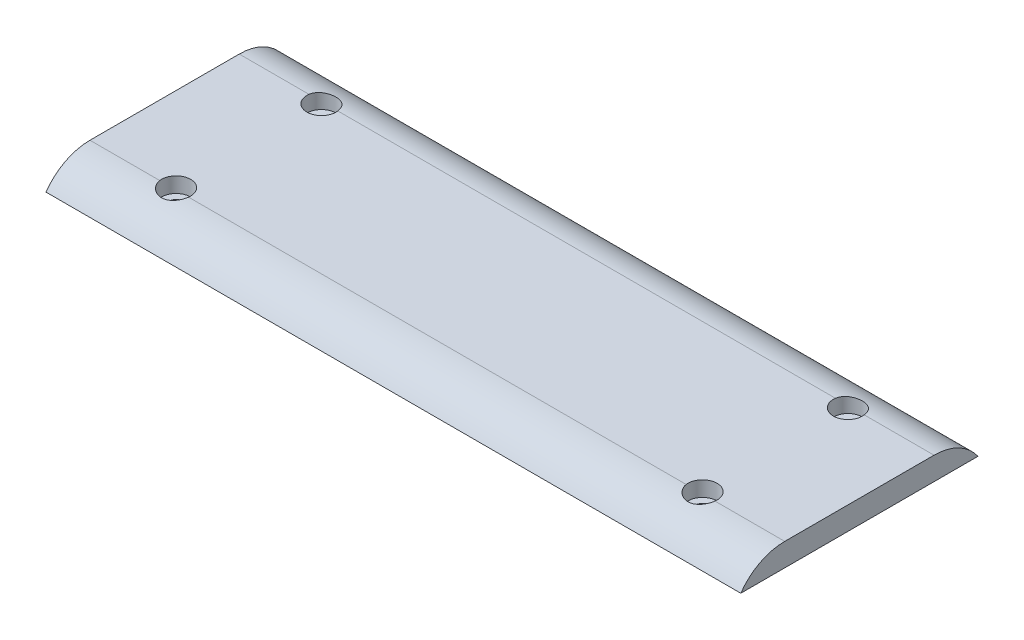
from build123d import *

# Parameters (mm, degrees)
SKETCH1_W           = 90.8
SKETCH1_H           = 31
BOSS_EXTRUDE1_DEPTH = 3
SKETCH2_R           = 0.95
CUT_EXTRUDE1_DEPTH  = 3
SKETCH3_R           = 1.9
CUT_EXTRUDE2_DEPTH  = 2
SKETCH4_W           = 54
SKETCH4_H           = 7
BOSS_EXTRUDE2_DEPTH = 5
SKETCH5_R           = 3.9
CUT_EXTRUDE3_DEPTH  = 54
FILLET1_R           = 7


with BuildPart() as part:
    # Sketch1 → Boss-Extrude1 (new body)
    with BuildSketch(Plane(origin=(0, 0, 0), x_dir=(1, 0, 0), z_dir=(0, 1, 0))):
        Rectangle(SKETCH1_W, SKETCH1_H)
    extrude(amount=BOSS_EXTRUDE1_DEPTH)

    # Sketch2 → Cut-Extrude1 (cut)
    with BuildSketch(Plane(origin=(0, 3, 0), x_dir=(1, 0, 0), z_dir=(0, 1, 0))):
        with Locations(Location((-34.4, 9.5, 0), (0, 0, 270))):
            Circle(SKETCH2_R)
        with Locations(Location((34.4, 9.5, 0), (0, 0, 270))):
            Circle(SKETCH2_R)
        with Locations(Location((-34.4, -9.5, 0), (0, 0, 270))):
            Circle(SKETCH2_R)
        with Locations(Location((34.4, -9.5, 0), (0, 0, 270))):
            Circle(SKETCH2_R)
    extrude(amount=-CUT_EXTRUDE1_DEPTH, mode=Mode.SUBTRACT)

    # Sketch3 → Cut-Extrude2 (cut)
    with BuildSketch(Plane(origin=(0, 3, 0), x_dir=(1, 0, 0), z_dir=(0, 1, 0))):
        with Locations(Location((-34.4, 9.5, 0), (0, 0, 270))):
            Circle(SKETCH3_R)
        with Locations(Location((-34.4, -9.5, 0), (0, 0, 270))):
            Circle(SKETCH3_R)
        with Locations(Location((34.4, 9.5, 0), (0, 0, 270))):
            Circle(SKETCH3_R)
        with Locations(Location((34.4, -9.5, 0), (0, 0, 270))):
            Circle(SKETCH3_R)
    extrude(amount=-CUT_EXTRUDE2_DEPTH, mode=Mode.SUBTRACT)

    # Sketch4 → Boss-Extrude2 (add)
    with BuildSketch(Plane.XZ):
        Rectangle(SKETCH4_W, SKETCH4_H)
    extrude(amount=BOSS_EXTRUDE2_DEPTH)

    # Sketch5 → Cut-Extrude3 (cut)
    with BuildSketch(Plane(origin=(27, 0, 0), x_dir=(0, 0, -1), z_dir=(1, 0, 0))):
        with Locations((0, -6.130658567)):
            Circle(SKETCH5_R)
    extrude(amount=-CUT_EXTRUDE3_DEPTH, mode=Mode.SUBTRACT)

    # Fillet1
    # the kernel refuses this fillet: 7 mm, written as the material it takes off along each edge
    with BuildSketch(Plane(origin=(59.761406616, 3, 15.5), x_dir=(0, 0, -1), z_dir=(-1, 0, 0))) as fillet1_piece_1:
        with BuildLine():
            CenterArc((5.744562647, 7), FILLET1_R, 214.849904579, 55.150095421)
            Line((0, 3), (-0.114891253, 2.92))
            ThreePointArc((-0.114891253, 2.92), (-0.14, 1.5), (-0.14, 0))
            Line((-0.14, 0), (0, -0.14))
            Line((0, -0.14), (5.744562647, -0.14))
            Line((5.744562647, -0.14), (5.744562647, 0))
        make_face()
    extrude(amount=119.522813233, mode=Mode.SUBTRACT)
    with BuildSketch(Plane(origin=(-59.761406616, 3, -15.5), x_dir=(0, -1, 0), z_dir=(1, 0, 0))) as fillet1_piece_2:
        with BuildLine():
            CenterArc((7, -5.744562647), FILLET1_R, 124.849904579, 55.150095421)
            Line((0, -5.744562647), (-0.14, -5.744562647))
            Line((-0.14, -5.744562647), (-0.14, 0))
            Line((-0.14, 0), (0, 0.14))
            ThreePointArc((0, 0.14), (1.5, 0.14), (2.92, 0.114891253))
            Line((2.92, 0.114891253), (3, 0))
        make_face()
    extrude(amount=119.522813233, mode=Mode.SUBTRACT)


solid = part.part
